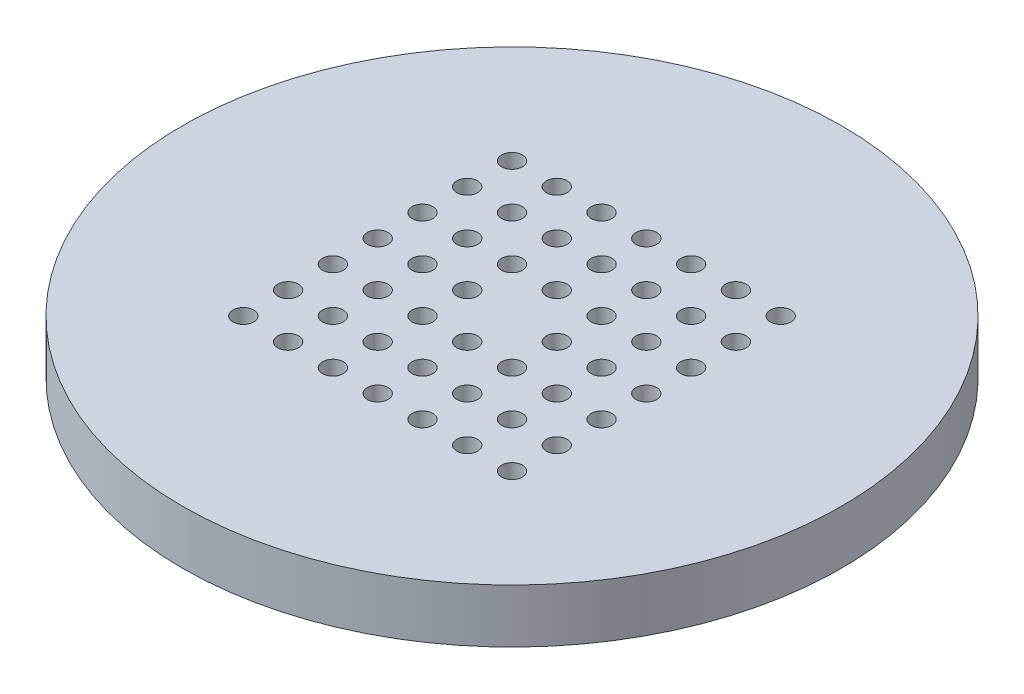
from build123d import *

# Parameters (mm, degrees)
SKETCH1_R                                 = 23.368
BILLET_DEPTH                              = 3.81
SKETCH2_R                                 = 0.7366
FIRST_LOX_HOLE_DEPTH                      = 34.266243371
BRAISING_CHAMFER_SIZE                     = 0.254
LOX_HOLE_PATTERN_COUNT                    = 7
LOX_HOLE_PATTERN_PITCH                    = 3.175
LOX_HOLE_PATTERN_COUNT_DIR2               = 7
LOX_HOLE_PATTERN_PITCH_DIR2               = 3.175
BRAISING_CHAMFER_OF_LOX_HOLE_PATTERN_SIZE = 0.254
SKETCH3_R                                 = 1.27
DOWEL_HOLE_1_DEPTH                        = 1.27
DOWEL_HOLE_2_COUNT                        = 2
DOWEL_HOLE_2_PITCH                        = 38.1


with BuildPart() as part:
    # Sketch1 → Billet (new body)
    with BuildSketch(Plane(origin=(0, 0, 0), x_dir=(1, 0, 0), z_dir=(0, 1, 0))):
        Circle(SKETCH1_R)
    extrude(amount=BILLET_DEPTH)

    # Sketch2 → First Lox Hole (cut, symmetric)
    with BuildSketch(Plane(origin=(0, 0, 0), x_dir=(1, 0, 0), z_dir=(0, 1, 0))):
        with Locations((9.525, 9.525)):
            Circle(SKETCH2_R)
    first_lox_hole = extrude(amount=FIRST_LOX_HOLE_DEPTH, both=True, mode=Mode.SUBTRACT)

    # Braising Chamfer
    braising_chamfer_edges = [part.edges().sort_by_distance(p)[0] for p in [
        (8.7884, 0, -9.525),
    ]]
    chamfer(braising_chamfer_edges, length=BRAISING_CHAMFER_SIZE)

    # Lox Hole Pattern: First Lox Hole 7 × 7, 1 skipped
    with Locations(*[(-i * LOX_HOLE_PATTERN_PITCH, 0, j * LOX_HOLE_PATTERN_PITCH_DIR2) for i in range(LOX_HOLE_PATTERN_COUNT) for j in range(LOX_HOLE_PATTERN_COUNT_DIR2) if (i, j) not in ((0, 0), (3, 3))]):
        add(first_lox_hole, mode=Mode.SUBTRACT)

    # Braising Chamfer of Lox Hole Pattern
    braising_chamfer_of_lox_hole_pattern_edges = [part.edges().sort_by_distance(p)[0] for p in [
        (8.7884, 0, -6.35),
        (8.7884, 0, -3.175),
        (8.7884, 0, 0),
        (8.7884, 0, 3.175),
        (8.7884, 0, 6.35),
        (8.7884, 0, 9.525),
        (5.6134, 0, -9.525),
        (5.6134, 0, -6.35),
        (5.6134, 0, -3.175),
        (5.6134, 0, 0),
        (5.6134, 0, 3.175),
        (5.6134, 0, 6.35),
        (5.6134, 0, 9.525),
        (2.4384, 0, -9.525),
        (2.4384, 0, -6.35),
        (2.4384, 0, -3.175),
        (2.4384, 0, 0),
        (2.4384, 0, 3.175),
        (2.4384, 0, 6.35),
        (2.4384, 0, 9.525),
        (-0.7366, 0, -9.525),
        (-0.7366, 0, -6.35),
        (-0.7366, 0, -3.175),
        (-0.7366, 0, 3.175),
        (-0.7366, 0, 6.35),
        (-0.7366, 0, 9.525),
        (-3.9116, 0, -9.525),
        (-3.9116, 0, -6.35),
        (-3.9116, 0, -3.175),
        (-3.9116, 0, 0),
        (-3.9116, 0, 3.175),
        (-3.9116, 0, 6.35),
        (-3.9116, 0, 9.525),
        (-7.0866, 0, -9.525),
        (-7.0866, 0, -6.35),
        (-7.0866, 0, -3.175),
        (-7.0866, 0, 0),
        (-7.0866, 0, 3.175),
        (-7.0866, 0, 6.35),
        (-7.0866, 0, 9.525),
        (-10.2616, 0, -9.525),
        (-10.2616, 0, -6.35),
        (-10.2616, 0, -3.175),
        (-10.2616, 0, 0),
        (-10.2616, 0, 3.175),
        (-10.2616, 0, 6.35),
        (-10.2616, 0, 9.525),
    ]]
    chamfer(braising_chamfer_of_lox_hole_pattern_edges, length=BRAISING_CHAMFER_OF_LOX_HOLE_PATTERN_SIZE)

    # Sketch3 → Dowel Hole 1 (cut)
    with BuildSketch(Plane.XZ):
        with Locations((-19.05, 0)):
            Circle(SKETCH3_R)
    dowel_hole_1 = extrude(amount=-DOWEL_HOLE_1_DEPTH, mode=Mode.SUBTRACT)

    # Dowel Hole 2: Dowel Hole 1 ×2
    with Locations(*[(i * DOWEL_HOLE_2_PITCH, 0, 0) for i in range(1, DOWEL_HOLE_2_COUNT)]):
        add(dowel_hole_1, mode=Mode.SUBTRACT)


solid = part.part
